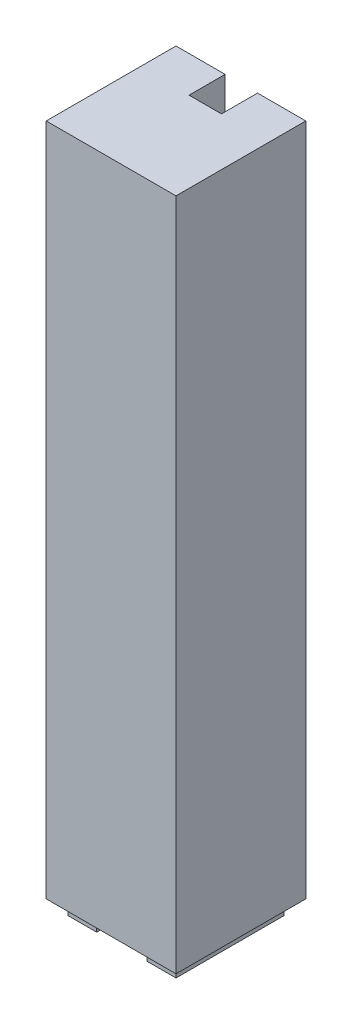
from build123d import *

# Parameters (mm, degrees)
SKETCH1_W           = 36
SKETCH1_H           = 36
BOSS_EXTRUDE1_DEPTH = 186.9
BOSS_EXTRUDE2_DEPTH = 4
SKETCH3_R           = 2
CUT_EXTRUDE1_DEPTH  = 5
SKETCH4_W           = 9
SKETCH4_H           = 186.9
CUT_EXTRUDE2_DEPTH  = 10


with BuildPart() as part:
    # Sketch1 → Boss-Extrude1 (new body)
    with BuildSketch(Plane(origin=(0, 0, 0), x_dir=(1, 0, 0), z_dir=(0, 1, 0))):
        with Locations((18, 18)):
            Rectangle(SKETCH1_W, SKETCH1_H)
    extrude(amount=BOSS_EXTRUDE1_DEPTH)

    # Sketch2 → Boss-Extrude2 (add)
    with BuildSketch(Plane.XZ):
        Polygon((3, -3), (7, -3), (11, -3), (11, -11), (7, -11), (7, -25), (11, -25), (11, -33), (7, -33), (3, -33), align=None)
        Polygon((29, -3), (33, -3), (33, -33), (29, -33), (25, -33), (25, -25), (29, -25), (29, -11), (25, -11), (25, -3), align=None)
    extrude(amount=BOSS_EXTRUDE2_DEPTH)

    # Sketch3 → Cut-Extrude1 (cut)
    with BuildSketch(Plane.XZ):
        with Locations((18, -18)):
            Circle(SKETCH3_R)
    extrude(amount=-CUT_EXTRUDE1_DEPTH, mode=Mode.SUBTRACT)

    # Sketch4 → Cut-Extrude2 (cut)
    with BuildSketch(Plane.XY.offset(-36)):
        with Locations((18.12, 93.45)):
            Rectangle(SKETCH4_W, SKETCH4_H)
    extrude(amount=CUT_EXTRUDE2_DEPTH, mode=Mode.SUBTRACT)


solid = part.part
